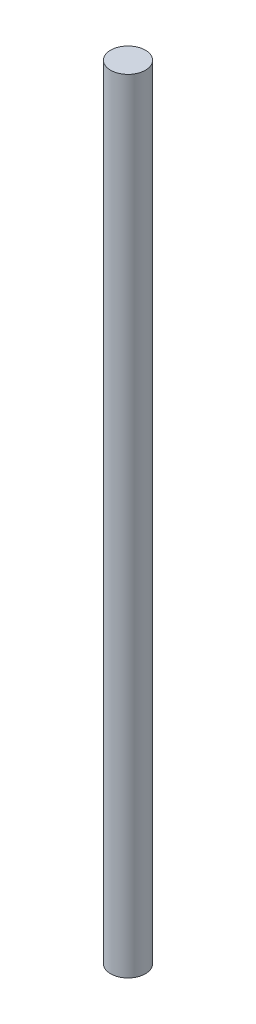
from build123d import *

# Parameters (mm, degrees)
SZKIC1_R                    = 1
DODANIE_WYCI_GNI_CIE1_DEPTH = 45


with BuildPart() as part:
    # Szkic1 → Dodanie-wyciągnięcie1 (new body)
    with BuildSketch(Plane(origin=(0, 0, 0), x_dir=(1, 0, 0), z_dir=(0, 1, 0))):
        Circle(SZKIC1_R)
    extrude(amount=DODANIE_WYCI_GNI_CIE1_DEPTH)


solid = part.part
